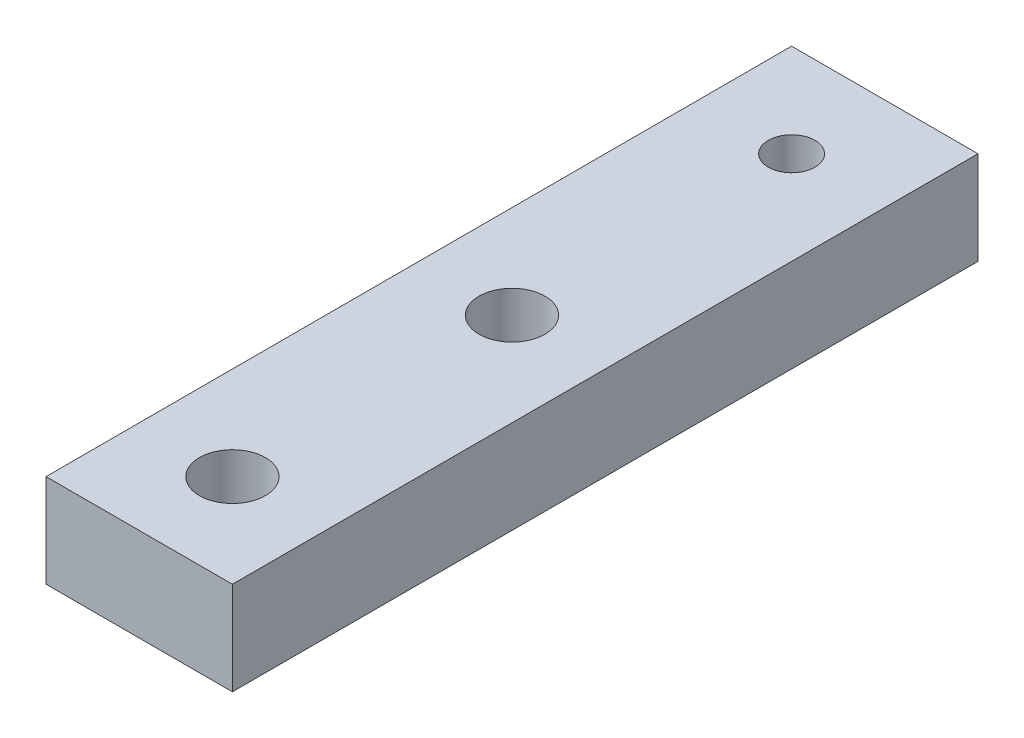
from build123d import *

# Parameters (mm, degrees)
SKETCH1_W             = 12.7
SKETCH1_H             = 50.8
BOSS_EXTRUDE1_DEPTH   = 6.35
SKETCH9_R             = 1.5875
CUT_EXTRUDE1_DEPTH    = 53.74706153
F_8_CLEARANCE_HOLE1_D = 4.4958


with BuildPart() as part:
    # Sketch1 → Boss-Extrude1 (new body)
    with BuildSketch(Plane(origin=(0, 0, 0), x_dir=(1, 0, 0), z_dir=(0, 1, 0))):
        with Locations((6.35, 25.4)):
            Rectangle(SKETCH1_W, SKETCH1_H)
    extrude(amount=BOSS_EXTRUDE1_DEPTH)

    # Sketch9 → Cut-Extrude1 (cut, through all)
    with BuildSketch(Plane(origin=(0, 6.35, 0), x_dir=(1, 0, 0), z_dir=(0, 1, 0))):
        with Locations((6.35, 44.45)):
            Circle(SKETCH9_R)
    extrude(amount=-CUT_EXTRUDE1_DEPTH, mode=Mode.SUBTRACT)

    # #8 Clearance Hole1 (through all)
    with Locations(Plane(origin=(0, 6.35, 0), x_dir=(1, 0, 0), z_dir=(0, 1, 0))):
        with Locations((6.35, 25.4), (6.35, 6.35)):
            Hole(F_8_CLEARANCE_HOLE1_D / 2)


solid = part.part
